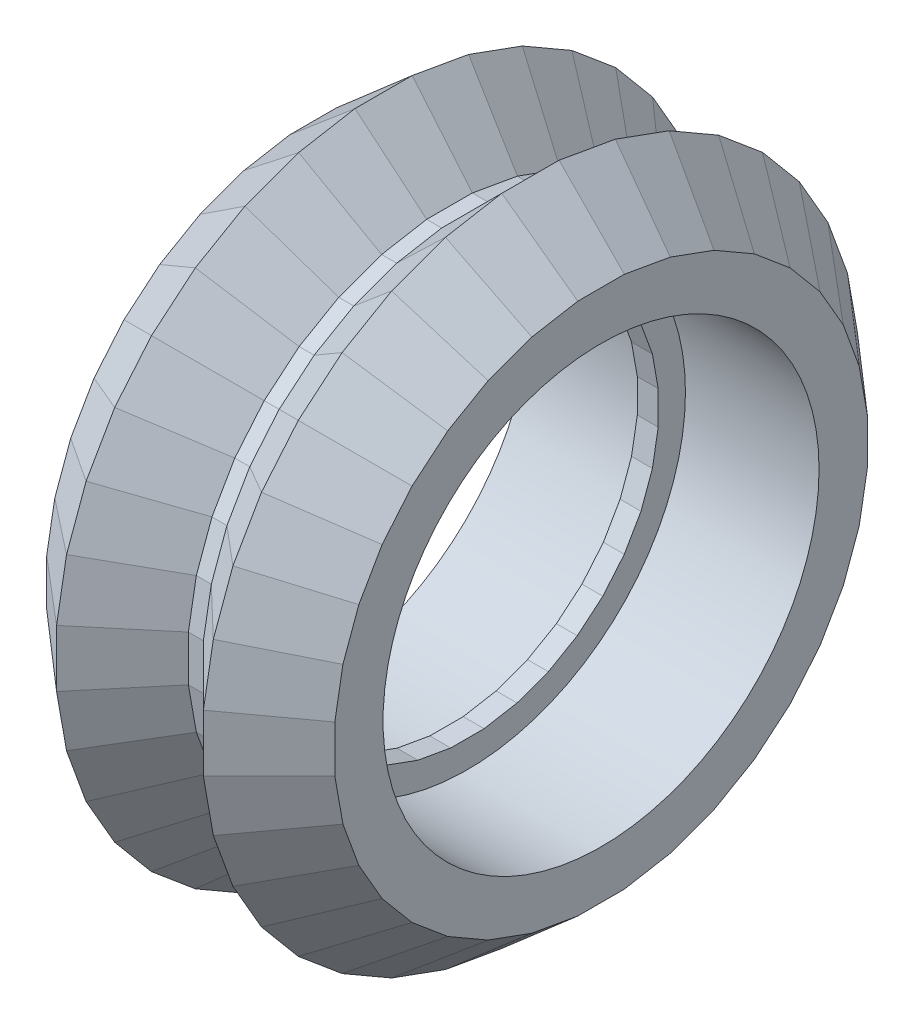
from build123d import *

# Parameters (mm, degrees)
SKETCH3_R          = 8
CUT_EXTRUDE1_DEPTH = 5
CUT_EXTRUDE2_START = 5
SKETCH4_R          = 8
CUT_EXTRUDE2_DEPTH = 5


with BuildPart() as part:
    # Sweep3: sweep along a path in Sketch2
    with BuildLine(Plane(origin=(0, 0, 0), x_dir=(0, 0, -1), z_dir=(1, 0, 0))) as sweep3_path:
        Line((3.117692302, -11.635386072), (5.090791138, -10.917236827))
        Line((5.090791138, -10.917236827), (6.909208862, -9.867372864))
        Line((6.909208862, -9.867372864), (8.517693771, -8.517693771))
        Line((8.517693771, -8.517693771), (9.867372864, -6.909208862))
        Line((9.867372864, -6.909208862), (10.917236827, -5.090791138))
        Line((10.917236827, -5.090791138), (11.635386072, -3.117692302))
        Line((11.635386072, -3.117692302), (12, -1.049863962))
        Line((12, -1.049863962), (12, 1.049863962))
        Line((12, 1.049863962), (11.635386072, 3.117692302))
        Line((11.635386072, 3.117692302), (10.917236827, 5.090791138))
        Line((10.917236827, 5.090791138), (9.867372864, 6.909208862))
        Line((9.867372864, 6.909208862), (8.517693771, 8.517693771))
        Line((8.517693771, 8.517693771), (6.909208862, 9.867372864))
        Line((6.909208862, 9.867372864), (5.090791138, 10.917236827))
        Line((5.090791138, 10.917236827), (3.117692302, 11.635386072))
        Line((3.117692302, 11.635386072), (1.049863962, 12))
        Line((1.049863962, 12), (-1.049863962, 12))
        Line((-1.049863962, 12), (-3.117692302, 11.635386072))
        Line((-3.117692302, 11.635386072), (-5.090791138, 10.917236827))
        Line((-5.090791138, 10.917236827), (-6.909208862, 9.867372864))
        Line((-6.909208862, 9.867372864), (-8.517693771, 8.517693771))
        Line((-8.517693771, 8.517693771), (-9.867372864, 6.909208862))
        Line((-9.867372864, 6.909208862), (-10.917236827, 5.090791138))
        Line((-10.917236827, 5.090791138), (-11.635386072, 3.117692302))
        Line((-11.635386072, 3.117692302), (-12, 1.049863962))
        Line((-12, 1.049863962), (-12, -1.049863962))
        Line((-12, -1.049863962), (-11.635386072, -3.117692302))
        Line((-11.635386072, -3.117692302), (-10.917236827, -5.090791138))
        Line((-10.917236827, -5.090791138), (-9.867372864, -6.909208862))
        Line((-9.867372864, -6.909208862), (-8.517693771, -8.517693771))
        Line((-8.517693771, -8.517693771), (-6.909208862, -9.867372864))
        Line((-6.909208862, -9.867372864), (-5.090791138, -10.917236827))
        Line((-5.090791138, -10.917236827), (-3.117692302, -11.635386072))
        Line((-3.117692302, -11.635386072), (-1.049863962, -12))
        Line((-1.049863962, -12), (1.049863962, -12))
        Line((1.049863962, -12), (3.117692302, -11.635386072))
    # Sketch1 → Sweep3 (sweep)
    with BuildSketch(Plane.XY):
        Polygon((-0.275, 9.581694808), (0.275, 9.581694808), (2.693305192, 12), (5.28627646, 9.77), (5.28627646, 7.782971269), (5.003305192, 7.5), (0.383305192, 7.5), (0.383305192, 7), (-0.383305192, 7), (-0.383305192, 7.5), (-5.003305192, 7.5), (-5.28627646, 7.782971269), (-5.28627646, 9.77), (-2.693305192, 12), align=None)
    sweep(path=sweep3_path.line, transition=Transition.RIGHT)

    # Sketch3 → Cut-Extrude1 (cut)
    with BuildSketch(Plane.ZY.offset(0.383305192)):
        Circle(SKETCH3_R)
    extrude(amount=CUT_EXTRUDE1_DEPTH, mode=Mode.SUBTRACT)

    # Sketch4 → Cut-Extrude2 (cut)
    with BuildSketch(Plane(origin=(0.383305192, 0, 0), x_dir=(0, 0, -1), z_dir=(1, 0, 0)).offset(CUT_EXTRUDE2_START)):
        Circle(SKETCH4_R)
    extrude(amount=-CUT_EXTRUDE2_DEPTH, mode=Mode.SUBTRACT)


solid = part.part
